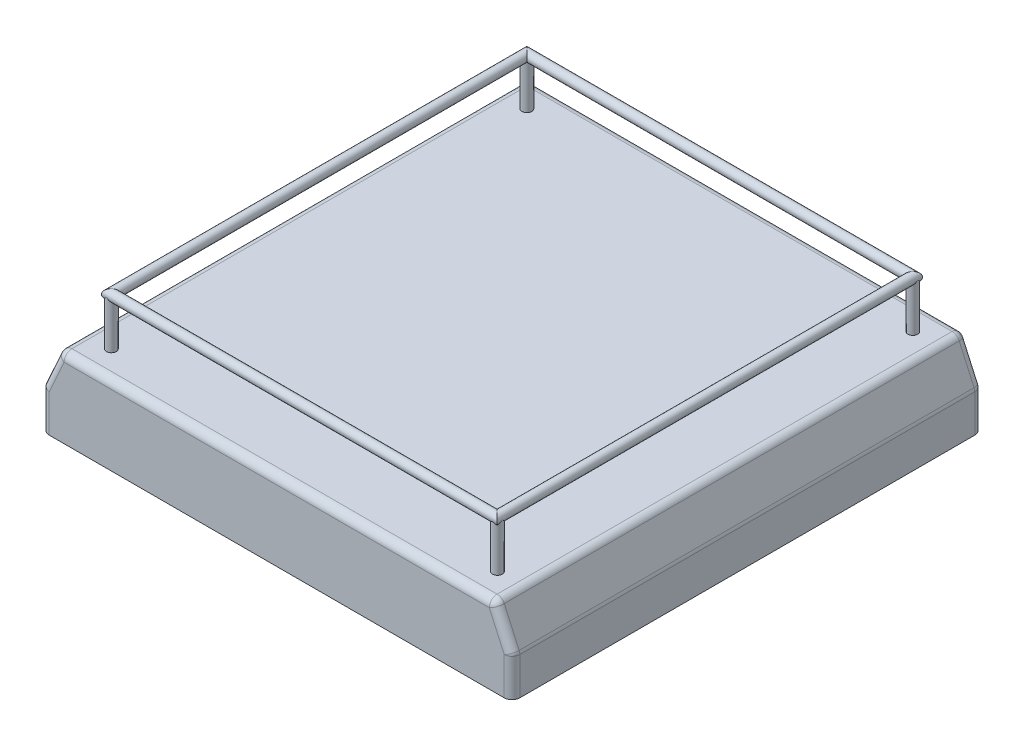
from build123d import *

# Parameters (mm, degrees)
BOSS_EXTRUDE1_START             = 20
BOSS_EXTRUDE1_DEPTH             = 1160
BOSS_EXTRUDE2_DEPTH             = 20
BOSS_EXTRUDE3_DEPTH             = 20
FILLET3_R                       = 20
FILLET4_R                       = 20
ROUND_END_25_X_2_4_1_DEPTH      = 1002.814245131
ROUND_END_25_X_2_4_1_DEPTH_BACK = 18.67766953
SKETCH1_R                       = 12.5
SKETCH1_R_2                     = 10.1
SKETCH1_ON_SEGMENT_2_R          = 12.5
SKETCH1_ON_SEGMENT_2_R_2        = 10.1
ROUND_END_25_X_2_4_1_2_DEPTH    = 1097.355339059
SKETCH1_ON_SEGMENT_3_R          = 12.5
SKETCH1_ON_SEGMENT_3_R_2        = 10.1
ROUND_END_25_X_2_4_1_3_DEPTH    = 1021.49191466
SKETCH1_ON_SEGMENT_4_R          = 12.5
SKETCH1_ON_SEGMENT_4_R_2        = 10.1
ROUND_END_25_X_2_4_1_4_DEPTH    = 1097.355339059
SKETCH11_R                      = 12.5
SKETCH11_R_2                    = 10.1
ROUND_END_25_X_2_4_2_DEPTH      = 119.891090049
SKETCH11_ON_SEGMENT_2_R         = 12.5
SKETCH11_ON_SEGMENT_2_R_2       = 10.1
ROUND_END_25_X_2_4_2_2_DEPTH    = 122.011142464
SKETCH11_ON_SEGMENT_3_R         = 12.5
SKETCH11_ON_SEGMENT_3_R_2       = 10.1
ROUND_END_25_X_2_4_2_3_DEPTH    = 124.554746476
SKETCH11_ON_SEGMENT_4_R         = 12.5
SKETCH11_ON_SEGMENT_4_R_2       = 10.1
ROUND_END_25_X_2_4_2_4_DEPTH    = 138.484540408
SKETCH12_W                      = 100
SKETCH12_H                      = 70
CUT_EXTRUDE1_DEPTH              = 10


with BuildPart() as part:
    # Sketch2 → Boss-Extrude1 (new body)
    with BuildSketch(Plane.XY.offset(BOSS_EXTRUDE1_START)):
        Polygon((-600, 72), (-600, 172), (-555, 272), (0, 272), (555, 272), (600, 172), (600, 72), (580, 72), (580, 167.707306223), (542.068287801, 252), (0, 252), (-542.068287801, 252), (-580, 167.707306223), (-580, 72), align=None)
    extrude(amount=BOSS_EXTRUDE1_DEPTH)

    # Sketch3 → Boss-Extrude2 (add)
    with BuildSketch(Plane.XY.offset(1180)):
        Polygon((600, 72), (600, 172), (555, 272), (-555, 272), (-600, 172), (-600, 72), align=None)
    extrude(amount=BOSS_EXTRUDE2_DEPTH)

    # Sketch4 → Boss-Extrude3 (add)
    with BuildSketch(Plane(origin=(0, 0, 20), x_dir=(-1, 0, 0), z_dir=(0, 0, -1))):
        Polygon((600, 172), (600, 72), (-600, 72), (-600, 172), (-555, 272), (555, 272), align=None)
    extrude(amount=BOSS_EXTRUDE3_DEPTH)

    # Fillet3
    fillet3_edges = [part.edges().sort_by_distance(p)[0] for p in [
        (-577.5, 222, 0),
        (0, 272, 0),
        (577.5, 222, 0),
        (600, 122, 0),
        (-600, 122, 0),
    ]]
    fillet(fillet3_edges, radius=FILLET3_R)

    # Fillet4
    # the kernel refuses this fillet: 20 mm, written as the material it adds along each edge
    with BuildSketch(Plane(origin=(-580, 167.707306223, 9.268265559), x_dir=(0, -1, 0), z_dir=(0, 0, 1))) as fillet4_piece_1:
        with BuildLine():
            CenterArc((FILLET4_R * 0.214634688829, FILLET4_R), FILLET4_R, 245.772254682, 24.227745318)
            Line((-FILLET4_R * 0.1957299885, FILLET4_R * 0.0880784948249), (0, 0))
            Line((0, 0), (FILLET4_R * 0.214634688829, 0))
        make_face()
    fillet4_piece_1_solid = extrude(amount=1181.463468883, mode=Mode.PRIVATE)
    add([fillet4_piece_1_solid])
    # the kernel refuses this fillet: 20 mm, written as the material it takes off along each edge
    with BuildSketch(Plane(origin=(580, 167.707306223, 20), x_dir=(1, 0, 0), z_dir=(0, 0, -1))) as fillet4_2_piece_1_section:
        Polygon((0, 0), (FILLET4_R, 0), (FILLET4_R, -FILLET4_R * 0.214634688829), (FILLET4_R * 0.911921505175, -FILLET4_R * 0.410364677329), align=None)
    fillet4_2_piece_1 = extrude(amount=FILLET4_R, mode=Mode.PRIVATE)
    fillet4_2_piece_1 = fillet4_2_piece_1 - Plane(origin=(580, 167.707306223, 20), x_dir=(-0.9777324545025357, -0.20985530113020012, 0), z_dir=(0, 0, -1)) * Sphere(FILLET4_R, mode=Mode.PRIVATE)
    with BuildSketch(Plane(origin=(542.068287801, 252, 20), x_dir=(0, 1, 0), z_dir=(0, 0, -1))) as fillet4_2_piece_2_section:
        Polygon((0, 0), (FILLET4_R, 0), (FILLET4_R, FILLET4_R * 0.646585609973), (FILLET4_R * 0.410364677329, FILLET4_R * 0.911921505175), align=None)
    fillet4_2_piece_2 = extrude(amount=FILLET4_R, mode=Mode.PRIVATE)
    fillet4_2_piece_2 = fillet4_2_piece_2 - Plane(origin=(542.068287801, 252, 20), x_dir=(-0.5429711422678011, -0.83975135526202, 0), z_dir=(0, 0, -1)) * Sphere(FILLET4_R, mode=Mode.PRIVATE)
    with BuildSketch(Plane(origin=(-542.068287801, 252, 20), x_dir=(-0.9119215051751061, 0.41036467732879867, 0), z_dir=(0, 0, -1))) as fillet4_2_piece_3_section:
        Polygon((0, 0), (FILLET4_R, 0), (FILLET4_R, FILLET4_R * 0.646585609973), (FILLET4_R * 0.410364677329, FILLET4_R * 0.911921505175), align=None)
    fillet4_2_piece_3 = extrude(amount=FILLET4_R, mode=Mode.PRIVATE)
    fillet4_2_piece_3 = fillet4_2_piece_3 - Plane(origin=(-542.068287801, 252, 20), x_dir=(0.5429711422678011, -0.83975135526202, 0), z_dir=(0, 0, -1)) * Sphere(FILLET4_R, mode=Mode.PRIVATE)
    with BuildSketch(Plane(origin=(-542.068287801, 252, 1180), x_dir=(0, 1, 0), z_dir=(0, 0, 1))) as fillet4_2_piece_4_section:
        Polygon((0, 0), (FILLET4_R, 0), (FILLET4_R, FILLET4_R * 0.646585609973), (FILLET4_R * 0.410364677329, FILLET4_R * 0.911921505175), align=None)
    fillet4_2_piece_4 = extrude(amount=FILLET4_R, mode=Mode.PRIVATE)
    fillet4_2_piece_4 = fillet4_2_piece_4 - Plane(origin=(-542.068287801, 252, 1180), x_dir=(0.5429711422678011, -0.83975135526202, 0), z_dir=(0, 0, 1)) * Sphere(FILLET4_R, mode=Mode.PRIVATE)
    with BuildSketch(Plane(origin=(542.068287801, 252, 1180), x_dir=(0, 1, 0), z_dir=(0, 0, 1))) as fillet4_2_piece_5_section:
        Polygon((0, 0), (FILLET4_R, 0), (FILLET4_R, -FILLET4_R * 0.646585609973), (FILLET4_R * 0.410364677329, -FILLET4_R * 0.911921505175), align=None)
    fillet4_2_piece_5 = extrude(amount=FILLET4_R, mode=Mode.PRIVATE)
    fillet4_2_piece_5 = fillet4_2_piece_5 - Plane(origin=(542.068287801, 252, 1180), x_dir=(-0.5429711422678011, -0.83975135526202, 0), z_dir=(0, 0, 1)) * Sphere(FILLET4_R, mode=Mode.PRIVATE)
    with BuildSketch(Plane(origin=(580, 167.707306223, 1180), x_dir=(1, 0, 0), z_dir=(0, 0, 1))) as fillet4_2_piece_6_section:
        Polygon((0, 0), (FILLET4_R, 0), (FILLET4_R, FILLET4_R * 0.214634688829), (FILLET4_R * 0.911921505175, FILLET4_R * 0.410364677329), align=None)
    fillet4_2_piece_6 = extrude(amount=FILLET4_R, mode=Mode.PRIVATE)
    fillet4_2_piece_6 = fillet4_2_piece_6 - Plane(origin=(580, 167.707306223, 1180), x_dir=(-0.9777324545025357, -0.20985530113020012, 0), z_dir=(0, 0, 1)) * Sphere(FILLET4_R, mode=Mode.PRIVATE)
    with BuildSketch(Plane(origin=(-555, 272, 1180), x_dir=(-0.41036467732879983, -0.9119215051751054, 0), z_dir=(0, 0, -1))) as fillet4_2_piece_7:
        with BuildLine():
            CenterArc((FILLET4_R * 0.646585609973, -FILLET4_R), FILLET4_R, 90, 65.772254682)
            Line((-FILLET4_R * 0.265335895202, -FILLET4_R * 0.589635322671), (0, 0))
            Line((0, 0), (FILLET4_R * 0.646585609973, 0))
        make_face()
    fillet4_2_piece_7_solid = extrude(amount=1160, mode=Mode.PRIVATE)
    with BuildSketch(Plane(origin=(555, 272, 20), x_dir=(-1, 0, 0), z_dir=(0, 0, 1))) as fillet4_2_piece_8:
        with BuildLine():
            CenterArc((FILLET4_R * 0.646585609973, FILLET4_R), FILLET4_R, 204.227745318, 65.772254682)
            Line((-FILLET4_R * 0.265335895202, FILLET4_R * 0.589635322671), (0, 0))
            Line((0, 0), (FILLET4_R * 0.646585609973, 0))
        make_face()
    fillet4_2_piece_8_solid = extrude(amount=1160, mode=Mode.PRIVATE)
    with BuildSketch(Plane(origin=(600, 172, 20), x_dir=(0, -1, 0), z_dir=(0, 0, 1))) as fillet4_2_piece_9:
        with BuildLine():
            CenterArc((FILLET4_R * 0.214634688829, -FILLET4_R), FILLET4_R, 90, 24.227745318)
            Line((-FILLET4_R * 0.1957299885, -FILLET4_R * 0.0880784948249), (0, 0))
            Line((0, 0), (FILLET4_R * 0.214634688829, 0))
        make_face()
    fillet4_2_piece_9_solid = extrude(amount=1160, mode=Mode.PRIVATE)
    with BuildSketch(Plane(origin=(600, 22, 1200), x_dir=(-1, 0, 0), z_dir=(0, 1, 0))) as fillet4_2_piece_10:
        with BuildLine():
            CenterArc((FILLET4_R, -FILLET4_R), FILLET4_R, 90, 90)
            Line((0, -FILLET4_R), (0, 0))
            Line((0, 0), (FILLET4_R, 0))
        make_face()
    fillet4_2_piece_10_solid = extrude(amount=145.707306223, mode=Mode.PRIVATE)
    with BuildSketch(Plane(origin=(598.238430104, 175.91459977, 1200), x_dir=(-0.911921505175106, -0.41036467732879867, 0), z_dir=(-0.41036467732879867, 0.9119215051751061, 0))) as fillet4_2_piece_11:
        with BuildLine():
            CenterArc((FILLET4_R, -FILLET4_R), FILLET4_R, 90, 90)
            Line((0, -FILLET4_R), (0, 0))
            Line((0, 0), (FILLET4_R, 0))
        make_face()
    fillet4_2_piece_11_solid = extrude(amount=92.434155021, mode=Mode.PRIVATE)
    with BuildSketch(Plane(origin=(542.068287801, 272, 1200), x_dir=(0, -1, 0), z_dir=(-1, 0, 0))) as fillet4_2_piece_12:
        with BuildLine():
            CenterArc((FILLET4_R, -FILLET4_R), FILLET4_R, 90, 90)
            Line((0, -FILLET4_R), (0, 0))
            Line((0, 0), (FILLET4_R, 0))
        make_face()
    fillet4_2_piece_12_solid = extrude(amount=1084.136575601, mode=Mode.PRIVATE)
    with BuildSketch(Plane(origin=(-560.306717904, 260.207293547, 1200), x_dir=(0, 0, -1), z_dir=(-0.41036467732879867, -0.9119215051751061, 0))) as fillet4_2_piece_13:
        with BuildLine():
            CenterArc((FILLET4_R, FILLET4_R), FILLET4_R, 180, 90)
            Line((0, FILLET4_R), (0, 0))
            Line((0, 0), (FILLET4_R, 0))
        make_face()
    fillet4_2_piece_13_solid = extrude(amount=146.726848798, mode=Mode.PRIVATE)
    with BuildSketch(Plane(origin=(-600, 222, 1200), x_dir=(0, 0, -1), z_dir=(0, -1, 0))) as fillet4_2_piece_14:
        with BuildLine():
            CenterArc((FILLET4_R, FILLET4_R), FILLET4_R, 180, 90)
            Line((0, FILLET4_R), (0, 0))
            Line((0, 0), (FILLET4_R, 0))
        make_face()
    fillet4_2_piece_14_solid = extrude(amount=200, mode=Mode.PRIVATE)
    add([fillet4_2_piece_1, fillet4_2_piece_2, fillet4_2_piece_3, fillet4_2_piece_4, fillet4_2_piece_5, fillet4_2_piece_6, fillet4_2_piece_7_solid, fillet4_2_piece_8_solid, fillet4_2_piece_9_solid, fillet4_2_piece_10_solid, fillet4_2_piece_11_solid, fillet4_2_piece_12_solid, fillet4_2_piece_13_solid, fillet4_2_piece_14_solid], mode=Mode.SUBTRACT)

    # Sketch12 → Cut-Extrude1 (cut)
    with BuildSketch(Plane.ZY.offset(600)):
        with Locations((600, 122.718867289)):
            Rectangle(SKETCH12_W, SKETCH12_H)
    extrude(amount=-CUT_EXTRUDE1_DEPTH, mode=Mode.SUBTRACT)


with BuildPart() as body_2:
    # Sketch1 → Round end 25 X 2.4(1) (new, two sides: drawn at the far end of the back side and taken through both)
    with BuildSketch(Plane(origin=(492.068287801, 392, 1130), x_dir=(0, 0, 1), z_dir=(-1, 0, 0)).offset(-ROUND_END_25_X_2_4_1_DEPTH_BACK)):
        Circle(SKETCH1_R)
        Circle(SKETCH1_R_2, mode=Mode.SUBTRACT)
    extrude(amount=ROUND_END_25_X_2_4_1_DEPTH + ROUND_END_25_X_2_4_1_DEPTH_BACK)

    # Round end 25 X 2.4(1) mitre 1
    split(bisect_by=Plane(origin=(492.068287801, 392, 1130), x_dir=(0, -1, 0), z_dir=(-0.707106781, 0, 0.707106781)), keep=Keep.TOP)

    # Round end 25 X 2.4(1) mitre 2
    split(bisect_by=Plane(origin=(-492.068287801, 392, 1130), x_dir=(0, 1, 0), z_dir=(0.707106781, 0, 0.707106781)), keep=Keep.TOP)


with BuildPart() as body_3:
    # Sketch1 on segment 2 (carried to segment 2) → Round end 25 X 2.4_1 2 (new body)
    with BuildSketch(Plane(origin=(-492.068287801, 392, 1148.67766953), x_dir=(-1, 0, 0), z_dir=(0, 0, -1))):
        Circle(SKETCH1_ON_SEGMENT_2_R)
        Circle(SKETCH1_ON_SEGMENT_2_R_2, mode=Mode.SUBTRACT)
    extrude(amount=ROUND_END_25_X_2_4_1_2_DEPTH)

    # Round end 25 X 2.4_1 2 mitre 1
    split(bisect_by=Plane(origin=(-492.068287801, 392, 1130), x_dir=(0, -1, 0), z_dir=(-0.707106781, 0, -0.707106781)), keep=Keep.TOP)

    # Round end 25 X 2.4_1 2 mitre 2
    split(bisect_by=Plane(origin=(-492.068287801, 392, 70), x_dir=(0, -1, 0), z_dir=(-0.707106781, 0, 0.707106781)), keep=Keep.TOP)


with BuildPart() as body_4:
    # Sketch1 on segment 3 (carried to segment 3) → Round end 25 X 2.4_1 3 (new body)
    with BuildSketch(Plane(origin=(-510.74595733, 392, 70), x_dir=(0, 0, -1), z_dir=(1, 0, 0))):
        Circle(SKETCH1_ON_SEGMENT_3_R)
        Circle(SKETCH1_ON_SEGMENT_3_R_2, mode=Mode.SUBTRACT)
    extrude(amount=ROUND_END_25_X_2_4_1_3_DEPTH)

    # Round end 25 X 2.4_1 3 mitre 1
    split(bisect_by=Plane(origin=(-492.068287801, 392, 70), x_dir=(0, 1, 0), z_dir=(0.707106781, 0, -0.707106781)), keep=Keep.TOP)

    # Round end 25 X 2.4_1 3 mitre 2
    split(bisect_by=Plane(origin=(492.068287801, 392, 70), x_dir=(0, -1, 0), z_dir=(-0.707106781, 0, -0.707106781)), keep=Keep.TOP)


with BuildPart() as body_5:
    # Sketch1 on segment 4 (carried to segment 4) → Round end 25 X 2.4_1 4 (new body)
    with BuildSketch(Plane(origin=(492.068287801, 392, 51.32233047), x_dir=(1, 0, 0), z_dir=(0, 0, 1))):
        Circle(SKETCH1_ON_SEGMENT_4_R)
        Circle(SKETCH1_ON_SEGMENT_4_R_2, mode=Mode.SUBTRACT)
    extrude(amount=ROUND_END_25_X_2_4_1_4_DEPTH)

    # Round end 25 X 2.4_1 4 mitre 1
    split(bisect_by=Plane(origin=(492.068287801, 392, 70), x_dir=(0, 1, 0), z_dir=(0.707106781, 0, 0.707106781)), keep=Keep.TOP)

    # Round end 25 X 2.4_1 4 mitre 2
    split(bisect_by=Plane(origin=(492.068287801, 392, 1130), x_dir=(0, 1, 0), z_dir=(0.707106781, 0, -0.707106781)), keep=Keep.TOP)


with BuildPart() as body_6:
    # Sketch11 → Round end 25 X 2.4(2) (new body)
    with BuildSketch(Plane(origin=(491.96815688, 392, 70), x_dir=(1, 0, 0), z_dir=(0, -1, 0))):
        Circle(SKETCH11_R)
        Circle(SKETCH11_R_2, mode=Mode.SUBTRACT)
    extrude(amount=ROUND_END_25_X_2_4_2_DEPTH)


with BuildPart() as body_7:
    # Sketch11 on segment 2 (carried to segment 2) → Round end 25 X 2.4_2 2 (new body)
    with BuildSketch(Plane(origin=(-492.068287801, 392, 70), x_dir=(1, 0, 0), z_dir=(0, -1, 0))):
        Circle(SKETCH11_ON_SEGMENT_2_R)
        Circle(SKETCH11_ON_SEGMENT_2_R_2, mode=Mode.SUBTRACT)
    extrude(amount=ROUND_END_25_X_2_4_2_2_DEPTH)


with BuildPart() as body_8:
    # Sketch11 on segment 3 (carried to segment 3) → Round end 25 X 2.4_2 3 (new body)
    with BuildSketch(Plane(origin=(492.068287801, 392, 1129.339370667), x_dir=(1, 0, 0), z_dir=(0, -1, 0))):
        Circle(SKETCH11_ON_SEGMENT_3_R)
        Circle(SKETCH11_ON_SEGMENT_3_R_2, mode=Mode.SUBTRACT)
    extrude(amount=ROUND_END_25_X_2_4_2_3_DEPTH)


with BuildPart() as body_9:
    # Sketch11 on segment 4 (carried to segment 4) → Round end 25 X 2.4_2 4 (new body)
    with BuildSketch(Plane(origin=(-491.571781073, 392, 1130), x_dir=(1, 0, 0), z_dir=(0, -1, 0))):
        Circle(SKETCH11_ON_SEGMENT_4_R)
        Circle(SKETCH11_ON_SEGMENT_4_R_2, mode=Mode.SUBTRACT)
    extrude(amount=ROUND_END_25_X_2_4_2_4_DEPTH)


solid = Compound([part.part, body_2.part, body_3.part, body_4.part, body_5.part, body_6.part, body_7.part, body_8.part, body_9.part])
